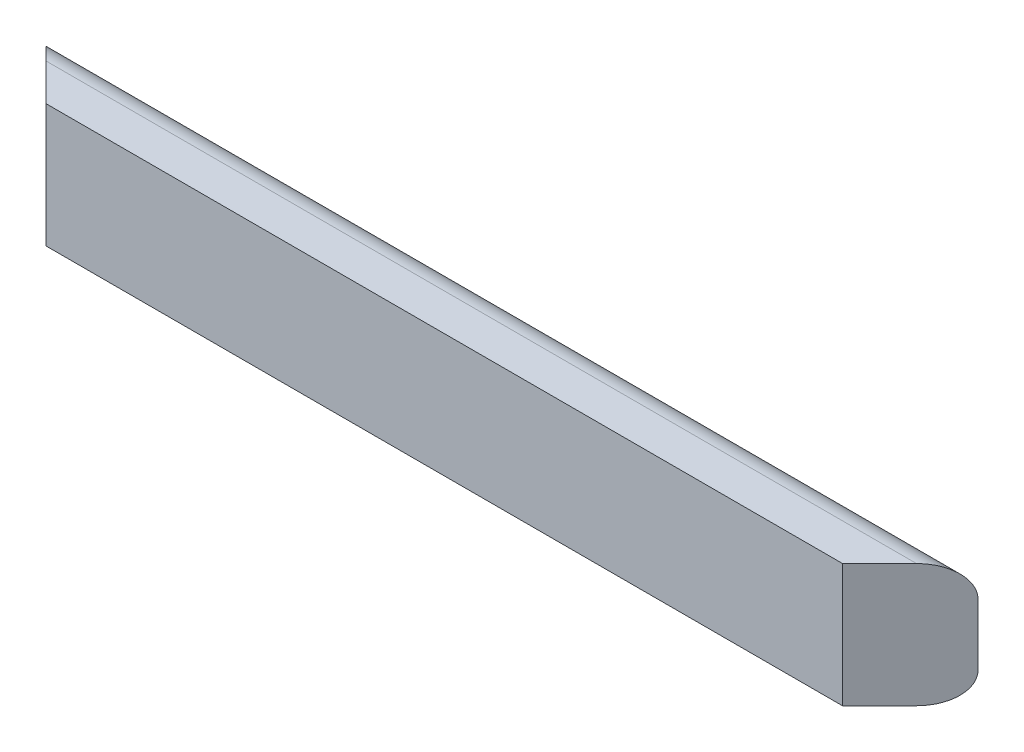
from build123d import *

# Parameters (mm, degrees)
BOSS_EXTRUDE1_DEPTH      = 480.1870635
BOSS_EXTRUDE1_DEPTH_BACK = 480.1870635
CUT_EXTRUDE1_DEPTH       = 502.585125829
BOSS_EXTRUDE3_DEPTH      = 0.254


with BuildPart() as part:
    # Sketch1 → Boss-Extrude1 (new, two sides: drawn at the far end of the back side and taken through both)
    with BuildSketch(Plane(origin=(0, 0, 0), x_dir=(0, 0, -1), z_dir=(1, 0, 0)).offset(-BOSS_EXTRUDE1_DEPTH_BACK)):
        with BuildLine():
            Line((6.35, 127), (38.1, 127))
            ThreePointArc((38.1, 127), (60.550640303, 117.700640303), (69.85, 95.25))
            Line((69.85, 95.25), (69.85, 31.75))
            ThreePointArc((69.85, 31.75), (60.550640303, 9.299359697), (38.1, 0))
            Line((38.1, 0), (6.35, 0))
            Line((6.35, 0), (0, 0))
            Line((0, 0), (0, 127))
            Line((0, 127), (6.35, 127))
        make_face()
    extrude(amount=BOSS_EXTRUDE1_DEPTH + BOSS_EXTRUDE1_DEPTH_BACK)

    # Sketch2 → Cut-Extrude1 (cut, through all)
    with BuildSketch(Plane(origin=(0, 127, 0), x_dir=(1, 0, 0), z_dir=(0, 1, 0))):
        Polygon((480.1870635, 69.85), (410.3370635, 0), (480.1870635, 0), align=None)
        Polygon((-480.1870635, 69.85), (-410.3370635, 0), (-480.1870635, 0), align=None)
    extrude(amount=-CUT_EXTRUDE1_DEPTH, mode=Mode.SUBTRACT)

    # Sketch4 → Boss-Extrude3 (add)
    # profile 1 of 4: a face of its own
    with BuildSketch(Plane(origin=(0, 0, -69.85), x_dir=(-1, 0, 0), z_dir=(0, 0, -1))):
        with BuildLine():
            Line((-141.487283737, 49.988561174), (-129.139597752, 51.506297576))
            add(Edge.make_bspline(
                [(-129.139597752, 51.506297576), (-129.032962671, 50.747064564), (-128.830554263, 49.305933343), (-128.199436765, 47.311224862), (-127.375544429, 45.575399002), (-126.284752313, 44.15314528), (-125.023613015, 43.021998512), (-123.617151139, 42.214884132), (-122.078088821, 41.705902447), (-121.006107171, 41.654466058), (-120.457631044, 41.628148788)],
                knots=[0, 0, 0, 0, 1.26631894, 2.403651751, 3.447242243, 4.428907923, 5.348362865, 6.231623936, 7.095215805, 8, 8, 8, 8], degree=3))
            add(Edge.make_bspline(
                [(-120.457631044, 41.628148788), (-120.161330426, 41.634511687), (-119.574405191, 41.647115596), (-118.711610093, 41.779355342), (-117.882599365, 41.996726001), (-117.095552411, 42.309506181), (-116.34671202, 42.698139812), (-115.626217183, 43.160949602), (-114.964334496, 43.738979779), (-114.318123207, 44.37140603), (-113.74466798, 45.091318713), (-113.239522217, 45.872393773), (-112.796104536, 46.706884108), (-112.452410387, 47.616306001), (-112.18337499, 48.58096015), (-111.991040418, 49.605033933), (-111.873985761, 50.684667137), (-111.859983423, 51.424537153), (-111.852837373, 51.802127553)],
                knots=[0, 0, 0, 0, 0.951760839, 1.885289532, 2.797832748, 3.70117291, 4.60103766, 5.506897018, 6.445598779, 7.420035506, 8.410036365, 9.396193293, 10.407074535, 11.440988179, 12.514285005, 13.622404236, 14.786601276, 16, 16, 16, 16], degree=3))
            add(Edge.make_bspline(
                [(-111.852837373, 51.802127553), (-111.879604371, 52.502912818), (-111.930665339, 53.839737143), (-112.325229706, 55.7363289), (-113.009474812, 57.403510016), (-113.968135732, 58.811372072), (-115.107297702, 59.943891395), (-116.38339385, 60.795183755), (-117.808484904, 61.284244815), (-118.799184723, 61.350799485), (-119.300035483, 61.384446364)],
                knots=[0, 0, 0, 0, 1.241512862, 2.368321189, 3.414110003, 4.41529485, 5.36642979, 6.245396713, 7.112955941, 8, 8, 8, 8], degree=3))
            add(Edge.make_bspline(
                [(-119.300035483, 61.384446364), (-119.656610092, 61.375322265), (-120.412510639, 61.355980138), (-121.58827301, 61.155013218), (-122.870446973, 60.877669799), (-123.74350999, 60.610883817), (-124.200523358, 60.471232088)],
                knots=[0, 0, 0, 0, 0.854525515, 1.811503923, 2.854410343, 4, 4, 4, 4], degree=3))
            Line((-124.200523358, 60.471232088), (-123.042927797, 70.439416087))
            add(Edge.make_bspline(
                [(-123.042927797, 70.439416087), (-122.699793823, 70.433529916), (-122.033943987, 70.422107829), (-121.061603486, 70.502723798), (-120.151462794, 70.649910548), (-119.305645566, 70.888720241), (-118.523364253, 71.178445171), (-117.797777169, 71.542462959), (-117.146635388, 71.995464307), (-116.353828061, 72.679267448), (-115.542714487, 73.703905506), (-114.809416499, 75.108914451), (-114.400837558, 76.710921704), (-114.349142899, 77.832955884), (-114.32237457, 78.413963285)],
                knots=[0, 0, 0, 0, 0.916749589, 1.778948191, 2.604102396, 3.376994206, 4.124053722, 4.831292757, 5.54010828, 6.238660037, 7.62386988, 9.002523041, 10.447858069, 12, 12, 12, 12], degree=3))
            add(Edge.make_bspline(
                [(-114.32237457, 78.413963285), (-114.340421784, 78.908707793), (-114.375026012, 79.857344611), (-114.685449372, 81.207210903), (-115.215277515, 82.398975794), (-115.956386082, 83.411952531), (-116.865477663, 84.234520651), (-117.928062929, 84.842338565), (-119.145149606, 85.196777383), (-120.000810014, 85.236190038), (-120.444768871, 85.256639269)],
                knots=[0, 0, 0, 0, 1.146968804, 2.199229744, 3.192297141, 4.153502289, 5.090509175, 6.0173182, 6.971286811, 8, 8, 8, 8], degree=3))
            add(Edge.make_bspline(
                [(-120.444768871, 85.256639269), (-120.889846441, 85.23463774), (-121.764714725, 85.191390357), (-123.016587755, 84.763605166), (-124.171507752, 84.101718979), (-125.190641675, 83.153836406), (-126.073947139, 81.974913825), (-126.758445098, 80.537127716), (-127.240501283, 78.863003816), (-127.406174904, 77.658066607), (-127.493239621, 77.024848612)],
                knots=[0, 0, 0, 0, 0.889956214, 1.749345552, 2.62404616, 3.543272128, 4.520224035, 5.562553653, 6.719074424, 8, 8, 8, 8], degree=3))
            Line((-127.493239621, 77.024848612), (-139.840925606, 78.87700151))
            add(Edge.make_bspline(
                [(-139.840925606, 78.87700151), (-139.637325698, 79.819720317), (-139.247589866, 81.624295295), (-138.451300452, 84.152640803), (-137.51697339, 86.384586473), (-136.425350386, 88.345144228), (-135.132300003, 90.068833733), (-133.597053466, 91.56499453), (-131.842580673, 92.877041648), (-129.872231734, 93.976422082), (-127.72989182, 94.857582736), (-125.449924009, 95.509752612), (-123.038143208, 95.883504452), (-121.389271871, 95.93280399), (-120.547666254, 95.957967122)],
                knots=[0, 0, 0, 0, 1.220808349, 2.336900656, 3.3513467, 4.279992853, 5.171472476, 6.069835959, 6.985198729, 7.938095762, 8.919113729, 9.91246339, 10.934493858, 12, 12, 12, 12], degree=3))
            add(Edge.make_bspline(
                [(-120.547666254, 95.957967122), (-119.826495707, 95.941556837), (-118.417458275, 95.909494092), (-116.362747759, 95.633600563), (-114.418641852, 95.185408458), (-112.582430461, 94.55140964), (-110.845601518, 93.744182635), (-109.237149801, 92.728555989), (-107.723332756, 91.556250599), (-106.826681472, 90.643909975), (-106.373551717, 90.18285149)],
                knots=[0, 0, 0, 0, 1.096978699, 2.143298912, 3.148181587, 4.128190255, 5.094201205, 6.055441919, 7.017302331, 8, 8, 8, 8], degree=3))
            add(Edge.make_bspline(
                [(-106.373551717, 90.18285149), (-106.023537684, 89.789960912), (-105.332223658, 89.013961265), (-104.434645502, 87.76983024), (-103.683420883, 86.477065821), (-103.046188148, 85.162642075), (-102.572302428, 83.796078916), (-102.21901684, 82.398827932), (-102.009177681, 80.958508612), (-101.986217703, 79.983817154), (-101.974688585, 79.494385809)],
                knots=[0, 0, 0, 0, 1.065582675, 2.104636323, 3.101288825, 4.092056841, 5.059084899, 6.026073946, 7.008813224, 8, 8, 8, 8], degree=3))
            add(Edge.make_bspline(
                [(-101.974688585, 79.494385809), (-101.999837567, 78.805967701), (-102.049410836, 77.448969012), (-102.504305984, 75.474938782), (-103.235446067, 73.608860109), (-104.24640348, 71.843604558), (-105.564457117, 70.195553035), (-107.18702939, 68.679534469), (-109.066442264, 67.237696856), (-110.47902046, 66.423262632), (-111.209728728, 66.001966436)],
                knots=[0, 0, 0, 0, 0.957571776, 1.887550067, 2.804499428, 3.740591036, 4.709432777, 5.731457079, 6.826512349, 8, 8, 8, 8], degree=3))
            add(Edge.make_bspline(
                [(-111.209728728, 66.001966436), (-110.774920169, 65.897167744), (-109.916890308, 65.690363151), (-108.677362831, 65.268754117), (-107.51653992, 64.727943501), (-106.405990923, 64.133720127), (-105.373275352, 63.429091991), (-104.398375528, 62.648317715), (-103.518575507, 61.746303626), (-102.675530041, 60.793323049), (-101.938600577, 59.747465525), (-101.272737218, 58.65913874), (-100.737902273, 57.501788739), (-100.280457077, 56.30517302), (-99.939604466, 55.04995027), (-99.672693466, 53.745511556), (-99.538908832, 52.383737677), (-99.516490646, 51.459364418), (-99.505151388, 50.99181066)],
                knots=[0, 0, 0, 0, 1.037381978, 2.047118658, 3.030848314, 4.005687143, 4.965748246, 5.927353932, 6.897971669, 7.885165084, 8.876109723, 9.862099733, 10.840989857, 11.829385213, 12.830906716, 13.855042526, 14.915067134, 16, 16, 16, 16], degree=3))
            add(Edge.make_bspline(
                [(-99.505151388, 50.99181066), (-99.51956021, 50.308923997), (-99.547976345, 48.962179679), (-99.860092867, 46.985641935), (-100.33429342, 45.08605931), (-100.987783847, 43.255757597), (-101.861740077, 41.517130623), (-102.906804937, 39.845787022), (-104.151443825, 38.258375189), (-105.570731672, 36.76692481), (-107.12155314, 35.401826739), (-108.787905722, 34.20277421), (-110.545100916, 33.187927397), (-112.403207023, 32.358101162), (-114.346066599, 31.712439867), (-116.390404873, 31.268680945), (-118.519638929, 30.972625251), (-119.976421673, 30.942228997), (-120.714874502, 30.926820934)],
                knots=[0, 0, 0, 0, 1.006520189, 1.984993146, 2.943645202, 3.891894145, 4.845023195, 5.808336607, 6.795092628, 7.815033679, 8.841288157, 9.838185905, 10.83832808, 11.829129029, 12.835072876, 13.85234392, 14.911338897, 16, 16, 16, 16], degree=3))
            add(Edge.make_bspline(
                [(-120.714874502, 30.926820934), (-121.414664815, 30.938552975), (-122.789217771, 30.961597466), (-124.80144877, 31.234596831), (-126.728716817, 31.636211012), (-128.559772747, 32.223729356), (-130.310566514, 32.947387314), (-131.948052536, 33.880254279), (-133.514382161, 34.940534945), (-134.958381911, 36.182569084), (-136.300989349, 37.536259204), (-137.480309186, 39.024940262), (-138.531240362, 40.601098684), (-139.435141753, 42.278708256), (-140.184438628, 44.062128348), (-140.767869909, 45.946755571), (-141.23316759, 47.926818682), (-141.401411105, 49.29184333), (-141.487283737, 49.988561174)],
                knots=[0, 0, 0, 0, 1.077528213, 2.11651914, 3.123276654, 4.10732375, 5.075386463, 6.036572488, 7.005896639, 7.98540975, 8.966414275, 9.939311093, 10.906719916, 11.882103104, 12.870994428, 13.882228509, 14.919075059, 16, 16, 16, 16], degree=3))
        make_face()
    # profile 2 of 4: a face of its own
    with BuildSketch(Plane(origin=(0, 0, -69.85), x_dir=(-1, 0, 0), z_dir=(0, 0, -1))):
        with BuildLine():
            Line((-62.462093433, 50.117182903), (-51.760765579, 51.506297576))
            add(Edge.make_bspline(
                [(-51.760765579, 51.506297576), (-51.642380093, 50.780568), (-51.41440933, 49.383056103), (-50.706719158, 47.432022129), (-49.721163459, 45.713239113), (-48.454544685, 44.265955932), (-47.012973527, 43.088892136), (-45.420400197, 42.249747655), (-43.725063478, 41.721422366), (-42.550922605, 41.659383078), (-41.959789828, 41.628148788)],
                knots=[0, 0, 0, 0, 1.154848647, 2.223851388, 3.245409892, 4.254330626, 5.232966172, 6.156270698, 7.071756339, 8, 8, 8, 8], degree=3))
            add(Edge.make_bspline(
                [(-41.959789828, 41.628148788), (-41.616370664, 41.634182289), (-40.944122367, 41.645992961), (-39.953467627, 41.780059227), (-39.007120064, 41.997870012), (-38.096125975, 42.293479709), (-37.229973938, 42.682269208), (-36.407893848, 43.158045805), (-35.626813523, 43.721477925), (-34.8827795, 44.358572654), (-34.195286077, 45.085965129), (-33.620713178, 45.923247733), (-33.111714207, 46.827631979), (-32.697063985, 47.823687055), (-32.398158929, 48.914903645), (-32.160358427, 50.082600806), (-32.039139227, 51.340876348), (-32.016273212, 52.204936271), (-32.004468003, 52.651030964)],
                knots=[0, 0, 0, 0, 0.981268084, 1.920847364, 2.851509818, 3.754644372, 4.654445699, 5.560569672, 6.465366234, 7.403985617, 8.358004942, 9.316972086, 10.299158387, 11.321223707, 12.392031981, 13.529051644, 14.724304971, 16, 16, 16, 16], degree=3))
            add(Edge.make_bspline(
                [(-32.004468003, 52.651030964), (-32.011143045, 53.071527767), (-32.024043665, 53.884207159), (-32.14373122, 55.061642393), (-32.327450959, 56.161966499), (-32.619720064, 57.177134497), (-32.953514389, 58.126018474), (-33.403553287, 58.974986748), (-33.897360682, 59.760920289), (-34.499236907, 60.441413996), (-35.155036013, 61.04267379), (-35.85345981, 61.578386386), (-36.602348538, 62.02538699), (-37.394245331, 62.409044411), (-38.242877677, 62.688498613), (-39.141362088, 62.874418229), (-40.077617441, 63.013987895), (-40.72018881, 63.025139942), (-41.046575552, 63.030804496)],
                knots=[0, 0, 0, 0, 1.29221626, 2.497420946, 3.635005972, 4.715822244, 5.741640361, 6.720139245, 7.663294346, 8.588224307, 9.502291809, 10.395891443, 11.288713187, 12.178904539, 13.095818132, 14.026458458, 14.997562253, 16, 16, 16, 16], degree=3))
            add(Edge.make_bspline(
                [(-41.046575552, 63.030804496), (-41.45922931, 63.016010253), (-42.282480026, 62.986495507), (-43.497746027, 62.746569399), (-44.680614197, 62.355968027), (-45.829855089, 61.812223729), (-46.94242819, 61.110991483), (-48.013516609, 60.24994579), (-49.061506146, 59.243900895), (-49.705242128, 58.483757088), (-50.03723441, 58.091730101)],
                knots=[0, 0, 0, 0, 0.931687088, 1.85873035, 2.786835662, 3.740075265, 4.723687035, 5.750832598, 6.840042753, 8, 8, 8, 8], degree=3))
            Line((-50.03723441, 58.091730101), (-60.815735301, 59.609466504))
            Line((-60.815735301, 59.609466504), (-53.40712371, 95.134788057))
            Line((-53.40712371, 95.134788057), (-22.126319215, 95.134788057))
            Line((-22.126319215, 95.134788057), (-22.126319215, 82.787102072))
            Line((-22.126319215, 82.787102072), (-43.503250577, 82.787102072))
            Line((-43.503250577, 82.787102072), (-46.024236465, 71.326906017))
            add(Edge.make_bspline(
                [(-46.024236465, 71.326906017), (-45.381816964, 71.697561885), (-44.130764923, 72.419379607), (-42.133452016, 73.162424748), (-40.125878911, 73.639323084), (-38.77255902, 73.701356019), (-38.101137958, 73.732132349)],
                knots=[0, 0, 0, 0, 1.060051984, 2.064352337, 3.039669322, 4, 4, 4, 4], degree=3))
            add(Edge.make_bspline(
                [(-38.101137958, 73.732132349), (-37.469945095, 73.715146712), (-36.223094674, 73.681593499), (-34.394484466, 73.406300074), (-32.640499622, 72.952588242), (-30.955217357, 72.321200736), (-29.350691977, 71.493616454), (-27.813091414, 70.49335495), (-26.36461393, 69.303058942), (-24.989696213, 67.957093414), (-23.73586773, 66.467944448), (-22.653087096, 64.844102956), (-21.717878139, 63.126012929), (-20.956507189, 61.294691655), (-20.383173048, 59.347591366), (-19.953801197, 57.301478184), (-19.713270125, 55.1434317), (-19.675867936, 53.671994501), (-19.656782018, 52.921136595)],
                knots=[0, 0, 0, 0, 0.974409932, 1.924837087, 2.848242317, 3.768103797, 4.697919751, 5.630842317, 6.595644344, 7.588240789, 8.59876155, 9.595918743, 10.597287627, 11.615415169, 12.652315553, 13.727511434, 14.840374562, 16, 16, 16, 16], degree=3))
            add(Edge.make_bspline(
                [(-19.656782018, 52.921136595), (-19.674008435, 52.290478014), (-19.70819943, 51.038746756), (-19.908190569, 49.186441287), (-20.281535625, 47.38868729), (-20.757123097, 45.635357275), (-21.414391177, 43.941141258), (-22.194366108, 42.294994206), (-23.126749606, 40.699872055), (-23.846097598, 39.693450362), (-24.209991225, 39.184335937)],
                knots=[0, 0, 0, 0, 1.027524957, 2.039431707, 3.02972907, 4.015954419, 4.995255842, 5.985553205, 6.980960039, 8, 8, 8, 8], degree=3))
            add(Edge.make_bspline(
                [(-24.209991225, 39.184335937), (-24.740475206, 38.528772068), (-25.784529389, 37.238546115), (-27.571811387, 35.542219666), (-29.515699496, 34.11760187), (-31.610928766, 32.947630365), (-33.855267088, 32.029523153), (-36.258840659, 31.391212776), (-38.804026141, 30.996298985), (-40.552052993, 30.950317625), (-41.445302912, 30.926820934)],
                knots=[0, 0, 0, 0, 1.018121711, 2.003781959, 2.967346956, 3.92281574, 4.896313303, 5.889026666, 6.921282725, 8, 8, 8, 8], degree=3))
            add(Edge.make_bspline(
                [(-41.445302912, 30.926820934), (-42.166315783, 30.939844326), (-43.574132764, 30.965273209), (-45.635849187, 31.216745865), (-47.589676133, 31.625295782), (-49.447940052, 32.192240734), (-51.199607305, 32.928566139), (-52.858287962, 33.817543442), (-54.410162381, 34.878876743), (-55.848084307, 36.104548031), (-57.16849389, 37.459270233), (-58.346241116, 38.941581824), (-59.394127645, 40.526691501), (-60.292161634, 42.230616097), (-61.057498838, 44.041405853), (-61.66689253, 45.968341085), (-62.168636561, 47.998571276), (-62.363191729, 49.403162141), (-62.462093433, 50.117182903)],
                knots=[0, 0, 0, 0, 1.098912142, 2.145685936, 3.161086862, 4.139124218, 5.10307886, 6.053641493, 7.003731987, 7.963777669, 8.929946266, 9.883471279, 10.846206077, 11.822909928, 12.81603559, 13.839338588, 14.901632394, 16, 16, 16, 16], degree=3))
        make_face()
    # profile 3 of 4: a face of its own
    with BuildSketch(Plane(origin=(0, 0, -69.85), x_dir=(-1, 0, 0), z_dir=(0, 0, -1))):
        with BuildLine():
            Line((18.209455003, 47.673370052), (30.557140988, 49.036760379))
            add(Edge.make_bspline(
                [(30.557140988, 49.036760379), (30.637994326, 48.445590088), (30.790823737, 47.328156849), (31.279511065, 45.794795533), (31.892008924, 44.478581747), (32.724355074, 43.419388765), (33.717669119, 42.610927467), (34.855326057, 42.027551658), (36.141865973, 41.691510589), (37.046257906, 41.649795905), (37.515576528, 41.628148788)],
                knots=[0, 0, 0, 0, 1.261142327, 2.383817955, 3.394783384, 4.319218401, 5.209639591, 6.086630953, 7.00709008, 8, 8, 8, 8], degree=3))
            add(Edge.make_bspline(
                [(37.515576528, 41.628148788), (37.82108926, 41.635229881), (38.424869783, 41.649224147), (39.308127474, 41.846519093), (40.162847532, 42.123113217), (40.980220047, 42.527938781), (41.752430951, 43.048944096), (42.49862858, 43.674368665), (43.195924432, 44.424262543), (43.888543524, 45.285004598), (44.515475303, 46.342388481), (45.068777974, 47.624884025), (45.585382265, 49.132135662), (46.00974389, 50.882888201), (46.391709615, 52.862052998), (46.723999497, 55.075963918), (46.993591195, 57.525973704), (47.112747025, 59.240222456), (47.175068376, 60.136815593)],
                knots=[0, 0, 0, 0, 0.636702566, 1.258306339, 1.881198412, 2.509855161, 3.155497192, 3.822694, 4.538353708, 5.290656154, 6.125969777, 7.095962945, 8.203044623, 9.449504243, 10.854253673, 12.411741228, 14.12325476, 16, 16, 16, 16], degree=3))
            add(Edge.make_bspline(
                [(47.175068376, 60.136815593), (46.780053355, 59.712840793), (46.001223909, 58.87691294), (44.71130418, 57.780208753), (43.337872185, 56.858167302), (41.887954292, 56.114969452), (40.376676573, 55.507774121), (38.779192363, 55.108371957), (37.117744626, 54.834342387), (35.981841775, 54.810896119), (35.406180172, 54.799013839)],
                knots=[0, 0, 0, 0, 1.041520616, 2.053509057, 3.037255372, 4.009786987, 4.979165048, 5.959157055, 6.965725879, 8, 8, 8, 8], degree=3))
            add(Edge.make_bspline(
                [(35.406180172, 54.799013839), (34.775120953, 54.817112148), (33.529147227, 54.852845749), (31.696139942, 55.112365051), (29.930031823, 55.554910939), (28.228003244, 56.168602168), (26.598658471, 56.982018065), (25.021221497, 57.94101676), (23.529542388, 59.101824931), (22.101856176, 60.398882812), (20.817953708, 61.859092441), (19.671322158, 63.424836719), (18.701040457, 65.104727317), (17.91842378, 66.896978746), (17.313156595, 68.790183052), (16.873104289, 70.782750287), (16.615986189, 72.885063224), (16.580967533, 74.323086545), (16.563096872, 75.056936158)],
                knots=[0, 0, 0, 0, 0.980269742, 1.935460739, 2.869230488, 3.804804075, 4.740187949, 5.694100724, 6.667990488, 7.67211685, 8.68661751, 9.683203946, 10.682901945, 11.694007529, 12.71565541, 13.766145059, 14.860022949, 16, 16, 16, 16], degree=3))
            add(Edge.make_bspline(
                [(16.563096872, 75.056936158), (16.579358734, 75.820994235), (16.611257549, 77.319749302), (16.891105872, 79.504796869), (17.318494615, 81.584769941), (17.956662218, 83.541236382), (18.750769394, 85.39520876), (19.737778026, 87.123436928), (20.884990955, 88.74995874), (22.225559796, 90.226408206), (23.682781679, 91.577954163), (25.254774523, 92.754100647), (26.932418562, 93.73702521), (28.700850793, 94.55387073), (30.573337417, 95.182961466), (32.537911021, 95.631263772), (34.596481997, 95.909234714), (36.001235713, 95.941500809), (36.718121808, 95.957967122)],
                knots=[0, 0, 0, 0, 1.1238417, 2.204496613, 3.236450213, 4.243990082, 5.227299393, 6.199188572, 7.167261658, 8.150145869, 9.127934804, 10.088143708, 11.032722787, 11.984040773, 12.949643861, 13.93368149, 14.945498424, 16, 16, 16, 16], degree=3))
            add(Edge.make_bspline(
                [(36.718121808, 95.957967122), (37.499663885, 95.936372471), (39.032175865, 95.894027903), (41.278242682, 95.541418364), (43.409401552, 94.941490996), (45.446828539, 94.136998461), (47.361156623, 93.065217924), (49.177290656, 91.771676373), (50.87096538, 90.229965387), (52.471833872, 88.470616193), (53.928355727, 86.437701122), (55.168440749, 84.088178395), (56.223269366, 81.444294852), (57.074690413, 78.500372651), (57.739976139, 75.2571666), (58.199148351, 71.714739072), (58.506399323, 67.872388312), (58.531967639, 65.209451336), (58.545229221, 63.828259215)],
                knots=[0, 0, 0, 0, 0.854852685, 1.67626545, 2.479841517, 3.273455256, 4.067207639, 4.874322592, 5.708061326, 6.568303409, 7.473035808, 8.43640186, 9.467839227, 10.582672616, 11.785182758, 13.086903962, 14.489057258, 16, 16, 16, 16], degree=3))
            add(Edge.make_bspline(
                [(58.545229221, 63.828259215), (58.52606159, 62.42569891), (58.489028928, 59.715893942), (58.190226205, 55.803928156), (57.717275991, 52.191835176), (57.021911158, 48.886068819), (56.149275747, 45.874742553), (55.051986756, 43.169327234), (53.774007676, 40.755869999), (52.277963864, 38.656593307), (50.633270353, 36.832085623), (48.865538969, 35.251440658), (46.97223569, 33.919424772), (44.969790555, 32.808349363), (42.828262634, 31.976311202), (40.577286451, 31.373516087), (38.210806803, 30.983032523), (36.59105741, 30.945785963), (35.766321013, 30.926820934)],
                knots=[0, 0, 0, 0, 1.487495966, 2.873904204, 4.158892752, 5.348685137, 6.453750751, 7.479786756, 8.440129076, 9.343583348, 10.206541379, 11.040779453, 11.853317241, 12.65721927, 13.463689683, 14.283322899, 15.125910407, 16, 16, 16, 16], degree=3))
            add(Edge.make_bspline(
                [(35.766321013, 30.926820934), (35.174171393, 30.939007153), (34.012346265, 30.962917083), (32.311353086, 31.155274015), (30.697323837, 31.489528146), (29.175630778, 31.956331344), (27.734397737, 32.530354721), (26.385860646, 33.258599195), (25.129668142, 34.124419027), (23.944430126, 35.101203305), (22.877760377, 36.233459151), (21.896551154, 37.483552941), (21.0163417, 38.863993528), (20.266693516, 40.386646363), (19.574694261, 42.016187918), (19.017259722, 43.788735665), (18.552348211, 45.684288067), (18.325771266, 46.998633491), (18.209455003, 47.673370052)],
                knots=[0, 0, 0, 0, 1.056675019, 2.073245589, 3.050223185, 3.994251036, 4.910773036, 5.814621688, 6.723026041, 7.630269412, 8.550362125, 9.493303905, 10.463425011, 11.466105649, 12.519144845, 13.620215273, 14.778306119, 16, 16, 16, 16], degree=3))
        make_face()
        with BuildLine():
            add(Edge.make_bspline(
                [(46.197543236, 74.748244008), (46.192995259, 75.156048345), (46.184156267, 75.94861615), (46.033839982, 77.096390923), (45.815742371, 78.171216494), (45.526890624, 79.185016488), (45.123602986, 80.121029748), (44.645261082, 80.993995513), (44.080043896, 81.796913755), (43.209927358, 82.734897139), (42.028819488, 83.744543753), (40.446606524, 84.62152998), (38.74720594, 85.168334822), (37.571066842, 85.226950878), (36.975365266, 85.256639269)],
                knots=[0, 0, 0, 0, 0.937516427, 1.822063352, 2.657744432, 3.45986214, 4.242145632, 4.997087526, 5.746986504, 6.494090859, 7.936347984, 9.300605415, 10.632786197, 12, 12, 12, 12], degree=3))
            add(Edge.make_bspline(
                [(36.975365266, 85.256639269), (36.419313856, 85.23142671), (35.337020127, 85.1823532), (33.788021298, 84.74130182), (32.38478746, 84.025462088), (31.362675998, 83.19033878), (30.634271685, 82.393802965), (30.177740451, 81.680286507), (29.789011167, 80.884969938), (29.467172874, 80.001072357), (29.213222033, 79.028114768), (29.03316865, 77.960908116), (28.935156065, 76.808046526), (28.919070985, 76.008914616), (28.910782857, 75.59714742)],
                knots=[0, 0, 0, 0, 1.397188569, 2.719475933, 4.017809812, 5.337496372, 6.01771949, 6.727108146, 7.460709441, 8.242571956, 9.09066939, 9.98839818, 10.963485712, 12, 12, 12, 12], degree=3))
            add(Edge.make_bspline(
                [(28.910782857, 75.59714742), (28.917415948, 75.176645173), (28.93023549, 74.363955259), (29.050489251, 73.186593506), (29.230890108, 72.094168937), (29.523932708, 71.095211047), (29.868235556, 70.175499084), (30.284003604, 69.332237197), (30.811986655, 68.596575836), (31.574683025, 67.724000391), (32.690543429, 66.835776981), (34.203521379, 66.061288394), (35.874923032, 65.582484293), (37.045062605, 65.528157919), (37.644198257, 65.500341693)],
                knots=[0, 0, 0, 0, 1.000122719, 1.932902026, 2.813346472, 3.630219284, 4.405058741, 5.14865055, 5.858963796, 6.55275156, 7.902081098, 9.220520156, 10.576848858, 12, 12, 12, 12], degree=3))
            add(Edge.make_bspline(
                [(37.644198257, 65.500341693), (38.226442431, 65.523155771), (39.36254862, 65.56767183), (40.978917558, 66.043138479), (42.462749954, 66.772451151), (43.548341231, 67.63319606), (44.3244001, 68.448453183), (44.823887088, 69.148575122), (45.25448236, 69.914845239), (45.59835283, 70.754069815), (45.868798685, 71.658960459), (46.05923458, 72.628038663), (46.177505057, 73.664886876), (46.190717154, 74.379194287), (46.197543236, 74.748244008)],
                knots=[0, 0, 0, 0, 1.470045212, 2.868431389, 4.227473852, 5.634383908, 6.348475288, 7.071419378, 7.805118666, 8.569021284, 9.362200428, 10.192314795, 11.06605236, 12, 12, 12, 12], degree=3))
        make_face(mode=Mode.SUBTRACT)
    # profile 4 of 4: a face of its own
    with BuildSketch(Plane(origin=(0, 0, -69.85), x_dir=(-1, 0, 0), z_dir=(0, 0, -1))):
        with BuildLine():
            Line((95.588287176, 82.787102072), (95.588287176, 95.134788057))
            Line((95.588287176, 95.134788057), (137.570419525, 95.134788057))
            Line((137.570419525, 95.134788057), (137.570419525, 86.079818334))
            add(Edge.make_bspline(
                [(137.570419525, 86.079818334), (137.132466652, 85.634215576), (136.232161359, 84.718184318), (134.942562083, 83.219008064), (133.633855634, 81.592138761), (132.333408388, 79.815654384), (131.000796599, 77.917617609), (129.694583854, 75.861644239), (128.369791871, 73.674406405), (126.586203006, 70.580554119), (124.501410169, 66.539027103), (122.295809638, 61.515202589), (120.416738972, 56.337091808), (119.130033868, 51.924959688), (118.260657453, 48.388642584), (117.692648976, 45.8028037), (117.214506378, 43.289733693), (116.825537694, 40.845015906), (116.535239413, 38.467535056), (116.30585427, 36.165556823), (116.192685302, 33.933467795), (116.175986043, 32.470381045), (116.167763818, 31.75)],
                knots=[0, 0, 0, 0, 0.628545797, 1.29210959, 1.98878689, 2.729126096, 3.507039704, 4.322017351, 5.179550397, 6.080149501, 7.915136253, 9.752312618, 11.597470118, 13.454141581, 14.373891568, 15.261584755, 16.117868869, 16.947726723, 17.752002974, 18.527724242, 19.275094557, 20, 20, 20, 20], degree=3))
            Line((116.167763818, 31.75), (103.820077833, 31.75))
            add(Edge.make_bspline(
                [(103.820077833, 31.75), (103.861365707, 32.843859978), (103.944400134, 35.043731895), (104.255069304, 38.345667879), (104.743008648, 41.659898836), (105.349062065, 44.994084575), (106.149203658, 48.340108138), (107.062410362, 51.71036421), (108.168622974, 55.086852328), (109.408657623, 58.463116455), (110.777590695, 61.80710167), (112.26953513, 65.077331726), (113.880634103, 68.253404415), (115.589935593, 71.3464789), (117.417324861, 74.34660455), (119.36417774, 77.250523525), (121.402878607, 80.079241784), (122.860574051, 81.884634059), (123.589237582, 82.787102072)],
                knots=[0, 0, 0, 0, 0.943249748, 1.896978291, 2.856365892, 3.829648507, 4.816416106, 5.820376826, 6.838120354, 7.877341886, 8.919613352, 9.951365796, 10.974227495, 11.988073359, 12.996274698, 14.000568529, 15.000536908, 16, 16, 16, 16], degree=3))
            Line((123.589237582, 82.787102072), (95.588287176, 82.787102072))
        make_face()
    extrude(amount=BOSS_EXTRUDE3_DEPTH)


solid = part.part
